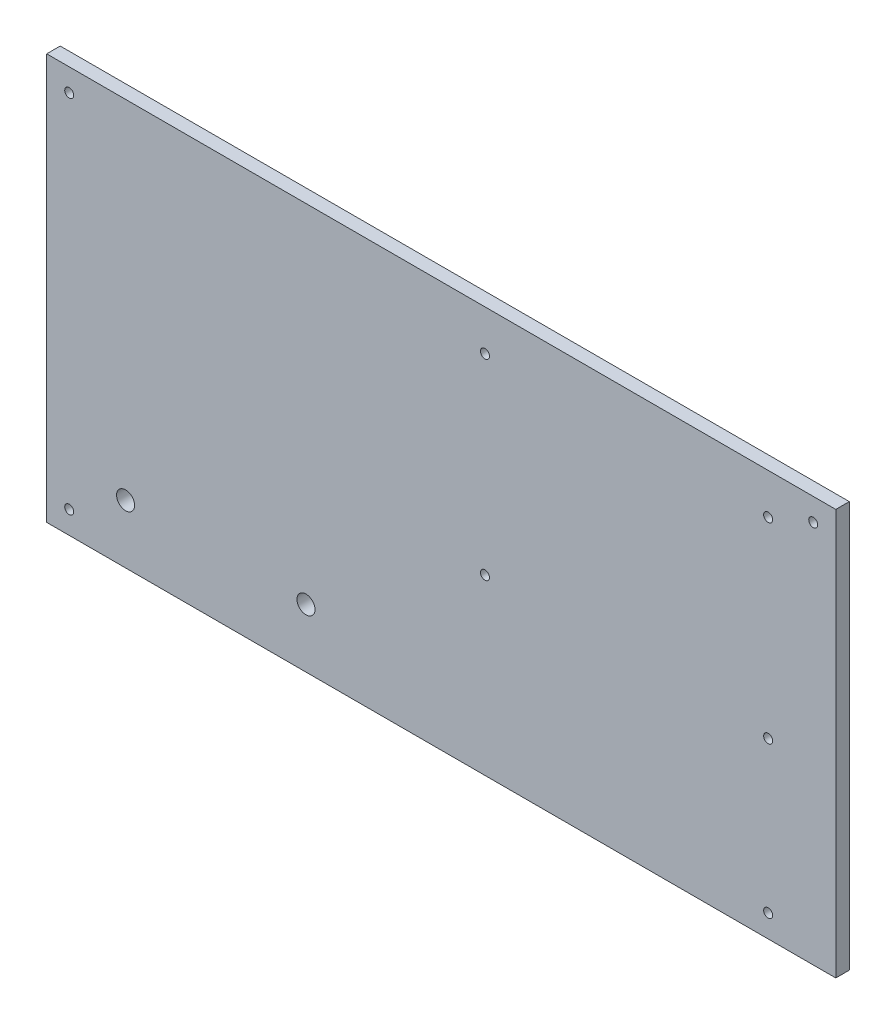
from build123d import *

# Parameters (mm, degrees)
ESBO_O1_W                = 350
ESBO_O1_H                = 180
ESBO_O1_R                = 2
ESBO_O1_R_2              = 4
RESSALTO_EXTRUS_O1_DEPTH = 6
ESBO_O2_R                = 2
CORTE_EXTRUS_O1_DEPTH    = 10


with BuildPart() as part:
    # Esboço1 → Ressalto-extrusão1 (new body)
    with BuildSketch(Plane.XY):
        Rectangle(ESBO_O1_W, ESBO_O1_H)
        with Locations((-165, -80)):
            Circle(ESBO_O1_R, mode=Mode.SUBTRACT)
        with Locations((-140, -64)):
            Circle(ESBO_O1_R_2, mode=Mode.SUBTRACT)
        with Locations((-60, -64)):
            Circle(ESBO_O1_R_2, mode=Mode.SUBTRACT)
        with Locations((145, -80)):
            Circle(ESBO_O1_R, mode=Mode.SUBTRACT)
        with Locations((-165, 80)):
            Circle(ESBO_O1_R, mode=Mode.SUBTRACT)
        with Locations((165, 80)):
            Circle(ESBO_O1_R, mode=Mode.SUBTRACT)
    extrude(amount=RESSALTO_EXTRUS_O1_DEPTH)

    # Esboço2 → Corte-extrusão1 (cut)
    with BuildSketch(Plane.XY.offset(6)):
        with Locations((145, 72)):
            Circle(ESBO_O2_R)
        with Locations((19.4, 72)):
            Circle(ESBO_O2_R)
        with Locations((19.4, -13)):
            Circle(ESBO_O2_R)
        with Locations((145, -13)):
            Circle(ESBO_O2_R)
    extrude(amount=-CORTE_EXTRUS_O1_DEPTH, mode=Mode.SUBTRACT)


solid = part.part
